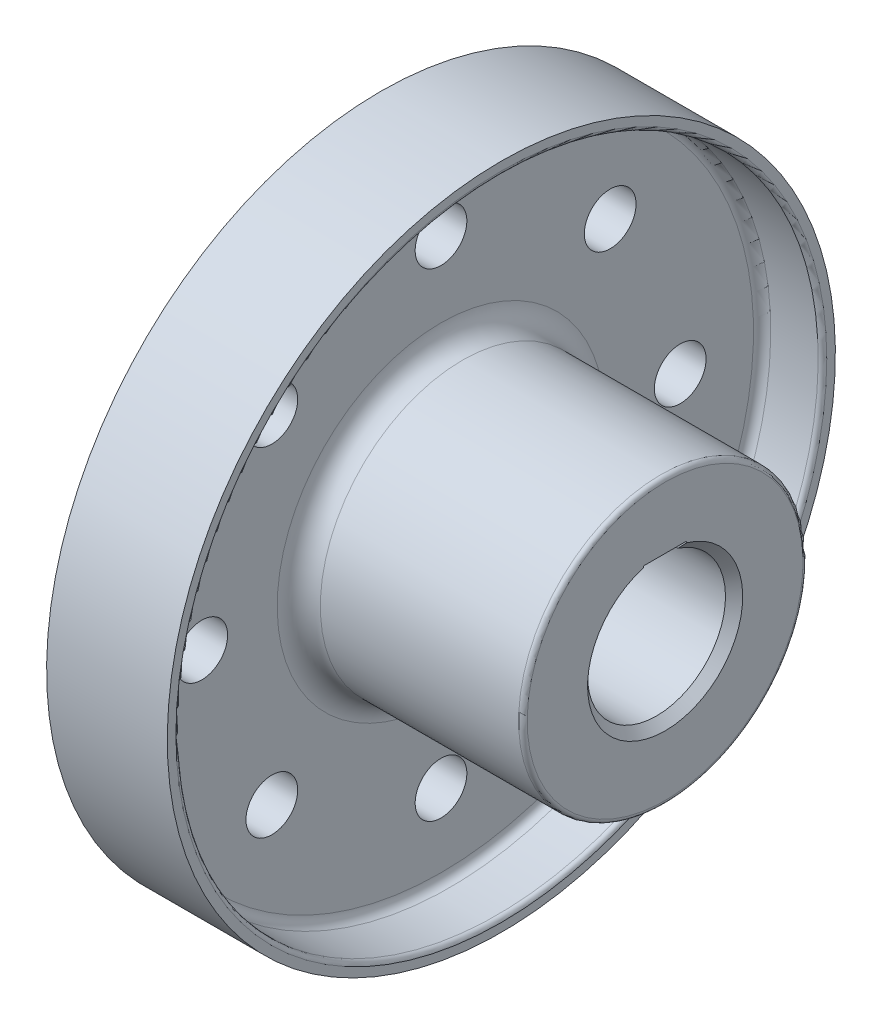
from build123d import *

# Parameters (mm, degrees)
SKETCH2_R          = 27.5
CUT_EXTRUDE1_DEPTH = 6
CUT_EXTRUDE2_DEPTH = 125.949989996
CHAMFER1_SIZE      = 2
FILLET1_R          = 1
FILLET2_R          = 2
FILLET3_R          = 5
SKETCH4_R          = 6
CUT_EXTRUDE3_DEPTH = 128.939438798


with BuildPart() as part:
    # Sketch1 → Revolve1 (revolve)
    with BuildSketch(Plane.XY):
        Polygon((7.191635476, 0), (7.191635476, 33), (-44.808364524, 33), (-44.808364524, 74.5), (-30.808364524, 74.5), (-30.808364524, 77.5), (-58.808364524, 77.5), (-58.808364524, 0), align=None)
    revolve(axis=Axis((7.191635476, 0, 0), (-1, 0, 0)))

    # Sketch2 → Cut-Extrude1 (cut)
    with BuildSketch(Plane.ZY.offset(58.808364524)):
        Circle(SKETCH2_R)
    extrude(amount=-CUT_EXTRUDE1_DEPTH, mode=Mode.SUBTRACT)

    # Sketch3 → Cut-Extrude2 (cut, through all)
    with BuildSketch(Plane.ZY.offset(52.808364524)):
        with BuildLine():
            Line((5, 17.65), (-5, 17.65))
            Line((-5, 17.65), (-5, 15.198684154))
            ThreePointArc((-5, 15.198684154), (0, -16), (5, 15.198684154))
            Line((5, 15.198684154), (5, 17.65))
        make_face()
    extrude(amount=-CUT_EXTRUDE2_DEPTH, mode=Mode.SUBTRACT)

    # Chamfer1
    chamfer1_edges = [part.edges().sort_by_distance(p)[0] for p in [
        (7.191635476, -16, 0),
    ]]
    chamfer(chamfer1_edges, length=CHAMFER1_SIZE)

    # Fillet1
    fillet1_edges = [part.edges().sort_by_distance(p)[0] for p in [
        (-30.808364524, -74.5, 0),
        (7.191635476, -33, 0),
    ]]
    fillet(fillet1_edges, radius=FILLET1_R)

    # Fillet2
    fillet2_edges = [part.edges().sort_by_distance(p)[0] for p in [
        (-44.808364524, -74.5, 0),
    ]]
    fillet(fillet2_edges, radius=FILLET2_R)

    # Fillet3
    fillet3_edges = [part.edges().sort_by_distance(p)[0] for p in [
        (-44.808364524, -33, 0),
    ]]
    fillet(fillet3_edges, radius=FILLET3_R)

    # Sketch4 → Cut-Extrude3 (cut, through all)
    with BuildSketch(Plane.ZY.offset(58.808364524)):
        with Locations((0, 55.5)):
            Circle(SKETCH4_R)
        with Locations((39.244426356, 39.244426356)):
            Circle(SKETCH4_R)
        with Locations((55.5, 0)):
            Circle(SKETCH4_R)
        with Locations((39.244426356, -39.244426356)):
            Circle(SKETCH4_R)
        with Locations((0, -55.5)):
            Circle(SKETCH4_R)
        with Locations((-39.244426356, -39.244426356)):
            Circle(SKETCH4_R)
        with Locations((-55.5, 0)):
            Circle(SKETCH4_R)
        with Locations((-39.244426356, 39.244426356)):
            Circle(SKETCH4_R)
    extrude(amount=-CUT_EXTRUDE3_DEPTH, mode=Mode.SUBTRACT)


solid = part.part
